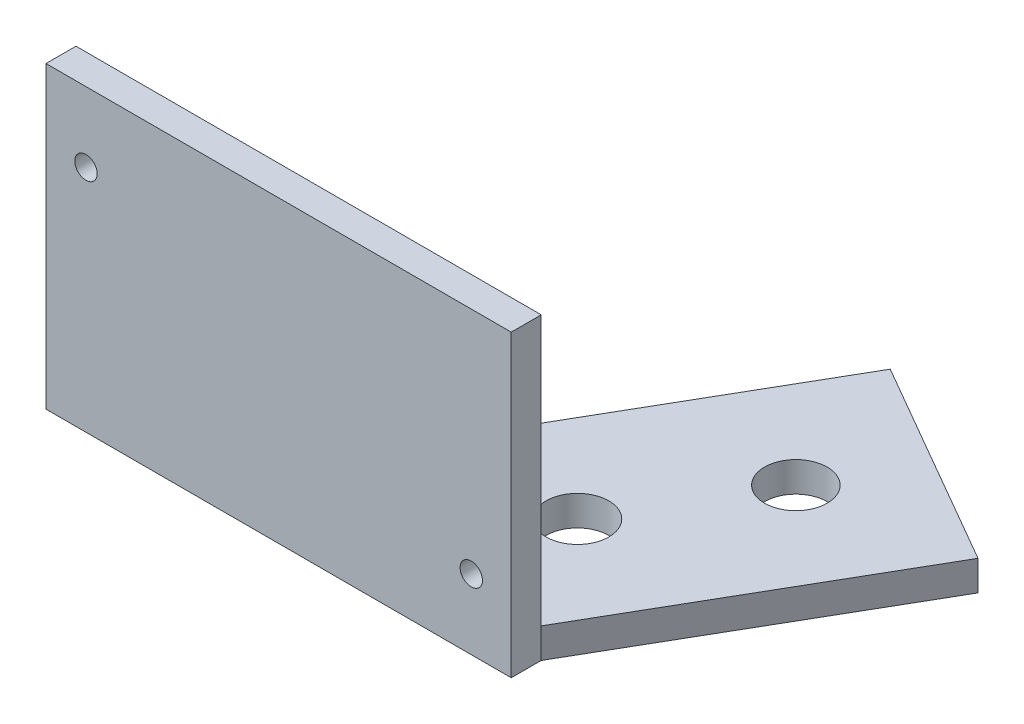
from build123d import *

# Parameters (mm, degrees)
SKETCH1_W           = 36.957
SKETCH1_H           = 21.3995
SKETCH1_R           = 0.889
BOSS_EXTRUDE1_DEPTH = 2.38125
BOSS_EXTRUDE3_DEPTH = 2.38125
CUT_EXTRUDE2_REACH  = 63.337
SKETCH4_R           = 2.4892


with BuildPart() as part:
    # Sketch1 → Boss-Extrude1 (new body)
    with BuildSketch(Plane.XY):
        with Locations((16.891, 9.11225)):
            Rectangle(SKETCH1_W, SKETCH1_H)
        with Locations((1.5875, 14.25575)):
            Circle(SKETCH1_R, mode=Mode.SUBTRACT)
        with Locations((32.1945, 1.5875)):
            Circle(SKETCH1_R, mode=Mode.SUBTRACT)
    extrude(amount=BOSS_EXTRUDE1_DEPTH)

    # Sketch2 → Boss-Extrude3 (add)
    with BuildSketch(Plane.XZ.offset(1.5875)):
        Polygon((-1.5875, 2.38125), (35.3695, 2.38125), (35.3695, 0), (48.0695, -21.997045256), (31.571716058, -31.522045256), (13.372454744, 0), (-1.5875, 0), align=None)
    extrude(amount=BOSS_EXTRUDE3_DEPTH)

    # Sketch4 → Cut-Extrude2 (cut, up to next)
    with BuildSketch(Plane(origin=(0, -1.5875, 0), x_dir=(1, 0, 0), z_dir=(0, 1, 0)), mode=Mode.PRIVATE) as cut_extrude2_sk1:
        with Locations((35.800977372, 19.797340731)):
            Circle(SKETCH4_R)
    cut_extrude2_tool1 = extrude(cut_extrude2_sk1.sketch, amount=-CUT_EXTRUDE2_REACH, mode=Mode.PRIVATE) & part.part
    # Sketch4 → Cut-Extrude2 (cut, up to next)
    with BuildSketch(Plane(origin=(0, -1.5875, 0), x_dir=(1, 0, 0), z_dir=(0, 1, 0)), mode=Mode.PRIVATE) as cut_extrude2_sk2:
        with Locations((29.450977372, 8.798818102)):
            Circle(SKETCH4_R)
    cut_extrude2_tool2 = extrude(cut_extrude2_sk2.sketch, amount=-CUT_EXTRUDE2_REACH, mode=Mode.PRIVATE) & part.part
    add(cut_extrude2_tool1.solids().sort_by_distance((35.800977, -1.5875, -19.797341))[0], mode=Mode.SUBTRACT)
    add(cut_extrude2_tool2.solids().sort_by_distance((29.450977, -1.5875, -8.798818))[0], mode=Mode.SUBTRACT)


solid = part.part
